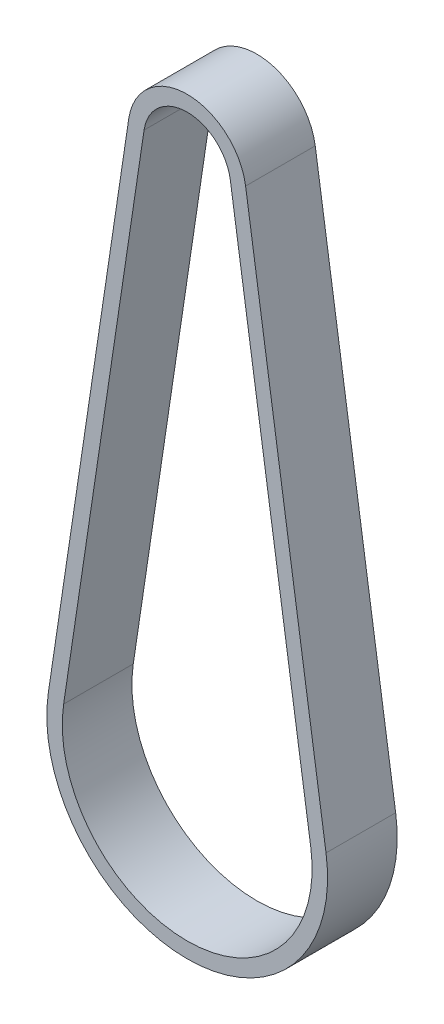
from build123d import *

# Parameters (mm, degrees)
EXTRUDE_THIN1_DEPTH = 4.5


with BuildPart() as part:
    # Sketch1 → Extrude-Thin1 (new, symmetric)
    with BuildSketch(Plane.XY):
        with BuildLine():
            Line((17.945099167, -68.314028873), (7.550886312, 1.13019507))
            ThreePointArc((7.550886312, 1.13019507), (0, 7.635), (-7.550886312, 1.13019507))
            Line((-7.550886312, 1.13019507), (-17.945099167, -68.314028873))
            ThreePointArc((-17.945099167, -68.314028873), (0, -89.145), (17.945099167, -68.314028873))
        make_face()
        with BuildLine():
            Line((15.967132877, -68.610085211), (5.572920022, 0.834138732))
            ThreePointArc((5.572920022, 0.834138732), (0, 5.635), (-5.572920022, 0.834138732))
            Line((-5.572920022, 0.834138732), (-15.967132877, -68.610085211))
            ThreePointArc((-15.967132877, -68.610085211), (0, -87.145), (15.967132877, -68.610085211))
        make_face(mode=Mode.SUBTRACT)
    extrude(amount=EXTRUDE_THIN1_DEPTH, both=True)


solid = part.part
